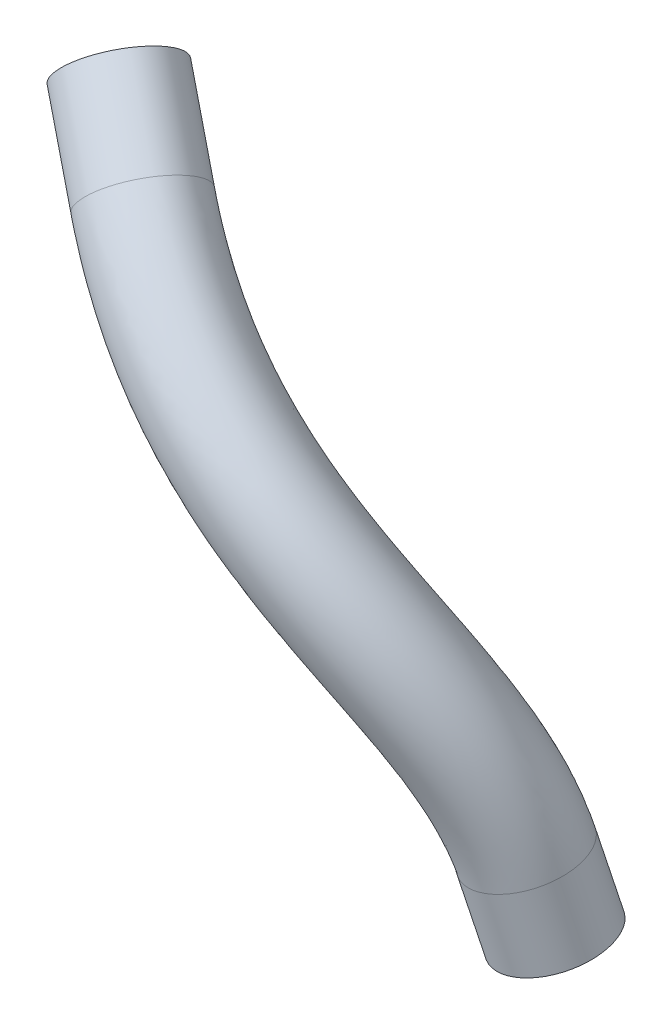
from build123d import *

# Parameters (mm, degrees)
SWEEP1_PROFILE_R     = 13.49375
CUT_SWEEP1_PROFILE_R = 9.525


with BuildPart() as part:
    # Sweep1: sweep along a curve in space
    with BuildLine() as sweep1_path:
        Line((27.501516454, -11.100021656, -13.942942833), (23.095618699, 7.173839424, -10.851573197))
        add(Edge.make_bspline(
            [(23.095618699, 7.173839424, -10.851573197), (13.261070206, 47.963522462, -3.951225916), (-24.995226117, 69.205872938, 24.492646263), (-71.502710672, 110.316771936, -5.131837889)],
            knots=[0, 0, 0, 0, 1, 1, 1, 1], degree=3))
        Line((-71.502710672, 110.316771936, -5.131837889), (-88.677665299, 125.498797619, -16.07199464))
    # Sweep1 profile (on start of the path) → Sweep1 (sweep)
    with BuildSketch(Plane(origin=(27.501516454, -11.100021656, -13.942942833), x_dir=(0.9721432612515079, 0.2343874561560038, 0), z_dir=(-0.23128072205980535, 0.9592577994369071, 0.1622766213074379))):
        Circle(SWEEP1_PROFILE_R)
    sweep(path=sweep1_path.line)

    # Cut-Sweep1: sweep along a curve in space
    with BuildLine() as cut_sweep1_path:
        Line((27.501516454, -11.100021656, -13.942942833), (23.095618699, 7.173839424, -10.851573197))
        add(Edge.make_bspline(
            [(23.095618699, 7.173839424, -10.851573197), (13.261070206, 47.963522462, -3.951225916), (-24.995226117, 69.205872938, 24.492646263), (-71.502710672, 110.316771936, -5.131837889)],
            knots=[0, 0, 0, 0, 1, 1, 1, 1], degree=3))
        Line((-71.502710672, 110.316771936, -5.131837889), (-88.677665299, 125.498797619, -16.07199464))
    # Cut-Sweep1 profile (on start of the path) → Cut-Sweep1 (sweep, cut)
    with BuildSketch(Plane(origin=(27.501516454, -11.100021656, -13.942942833), x_dir=(0.9721432612515079, 0.2343874561560038, 0), z_dir=(-0.23128072205980535, 0.9592577994369071, 0.1622766213074379))):
        Circle(CUT_SWEEP1_PROFILE_R)
    sweep(path=cut_sweep1_path.line, mode=Mode.SUBTRACT)


solid = part.part
